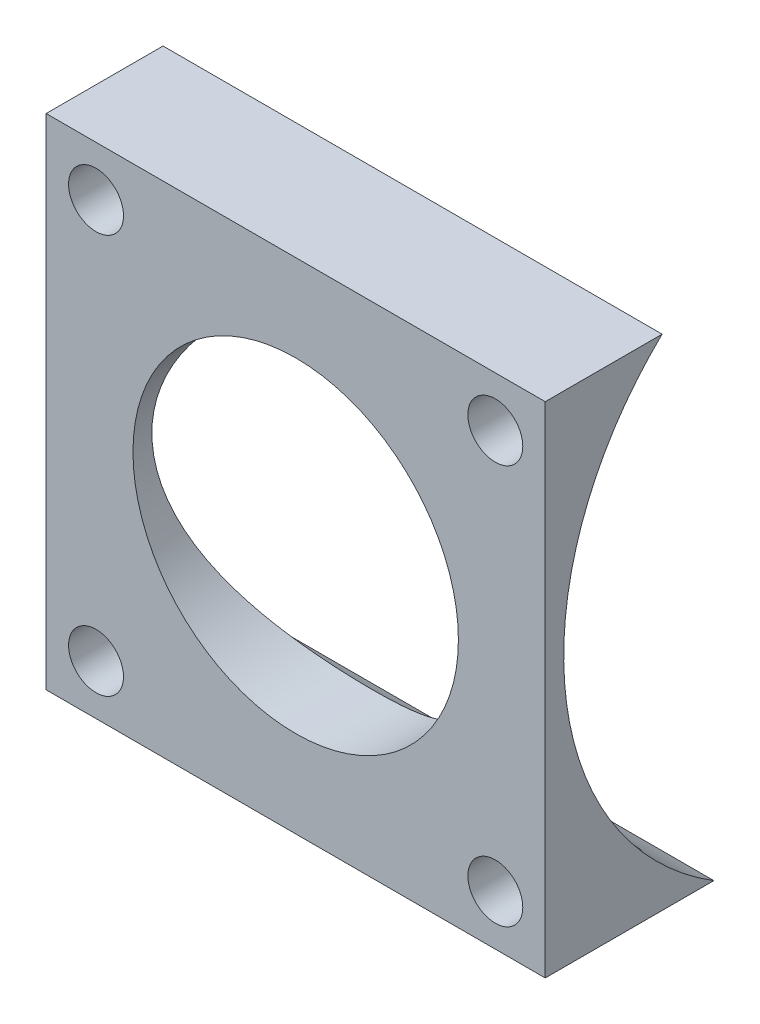
from build123d import *

# Parameters (mm, degrees)
SKETCH1_W               = 50
SKETCH1_H               = 50
SKETCH1_R               = 16.3
SKETCH1_R_2             = 2.75
BOSS_EXTRUDE1_DEPTH     = 33.6
CUT_EXTRUDE1_DEPTH      = 50.829308645
CUT_EXTRUDE1_DEPTH_BACK = 50.829308645
SKETCH2_R               = 31.75


with BuildPart() as part:
    # Sketch1 → Boss-Extrude1 (new body)
    with BuildSketch(Plane.XY):
        with Locations((0, -2)):
            Rectangle(SKETCH1_W, SKETCH1_H)
        with Locations((0, -2)):
            Circle(SKETCH1_R, mode=Mode.SUBTRACT)
        with Locations((-20, 18)):
            Circle(SKETCH1_R_2, mode=Mode.SUBTRACT)
        with Locations((20, 18)):
            Circle(SKETCH1_R_2, mode=Mode.SUBTRACT)
        with Locations((20, -22)):
            Circle(SKETCH1_R_2, mode=Mode.SUBTRACT)
        with Locations((-20, -22)):
            Circle(SKETCH1_R_2, mode=Mode.SUBTRACT)
    extrude(amount=BOSS_EXTRUDE1_DEPTH)

    # Sketch2 → Cut-Extrude1 (cut, two sides: drawn at the far end of the back side and taken through both)
    with BuildSketch(Plane(origin=(0, 0, 0), x_dir=(0, 0, -1), z_dir=(1, 0, 0)).offset(-CUT_EXTRUDE1_DEPTH_BACK)):
        Circle(SKETCH2_R)
    extrude(amount=CUT_EXTRUDE1_DEPTH + CUT_EXTRUDE1_DEPTH_BACK, mode=Mode.SUBTRACT)


solid = part.part
